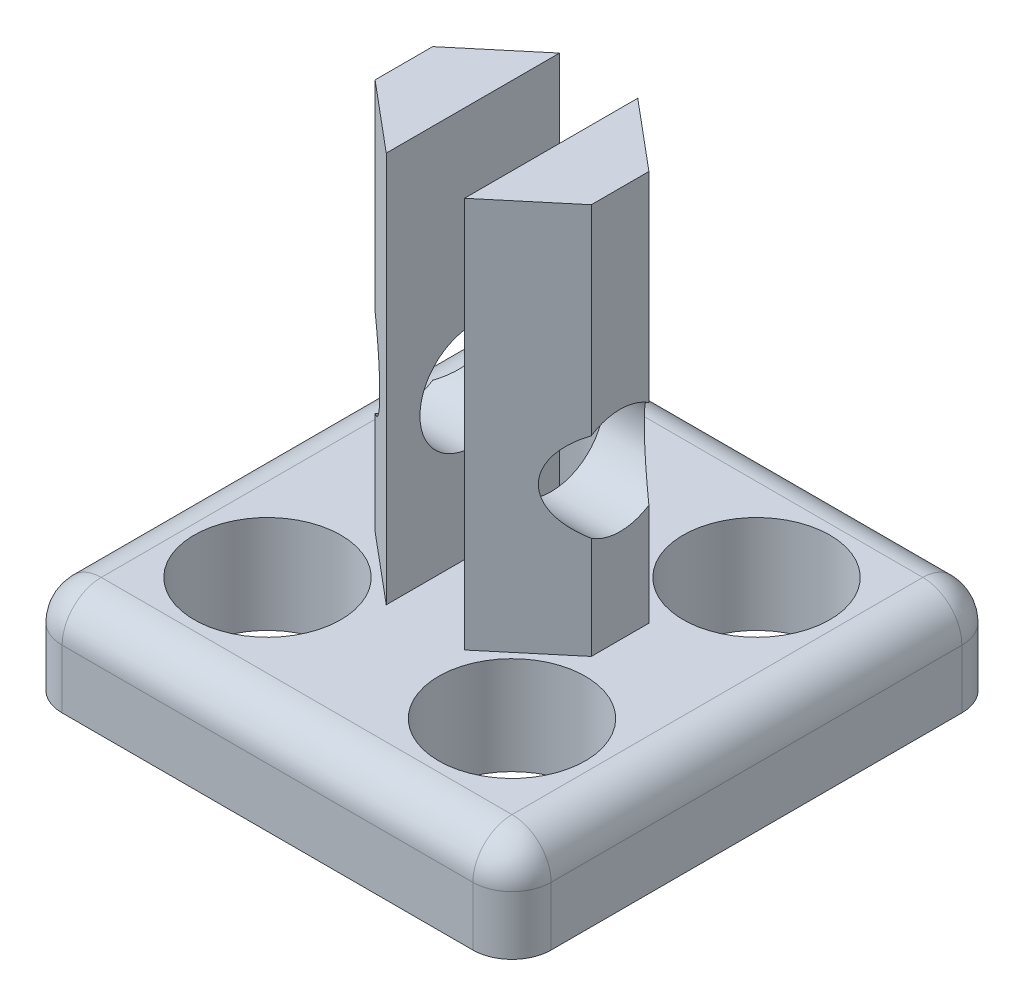
from build123d import *

# Parameters (mm, degrees)
SKETCH1_W           = 12.7
SKETCH1_H           = 12.7
SKETCH1_R           = 1.905
BOSS_EXTRUDE1_DEPTH = 2.54
BOSS_EXTRUDE2_DEPTH = 10.16
SKETCH3_R           = 1.375
CUT_EXTRUDE1_DEPTH  = 17.896123524
FILLET1_R           = 1.016


with BuildPart() as part:
    # Sketch1 → Boss-Extrude1 (new body)
    with BuildSketch(Plane(origin=(0, 0, 0), x_dir=(1, 0, 0), z_dir=(0, 1, 0))):
        Rectangle(SKETCH1_W, SKETCH1_H)
        with Locations((-3.175, 3.175)):
            Circle(SKETCH1_R, mode=Mode.SUBTRACT)
        with Locations((3.175, 3.175)):
            Circle(SKETCH1_R, mode=Mode.SUBTRACT)
        with Locations((3.175, -3.175)):
            Circle(SKETCH1_R, mode=Mode.SUBTRACT)
        with Locations((-3.175, -3.175)):
            Circle(SKETCH1_R, mode=Mode.SUBTRACT)
    extrude(amount=BOSS_EXTRUDE1_DEPTH)

    # Sketch2 → Boss-Extrude2 (add)
    with BuildSketch(Plane(origin=(0, 2.54, 0), x_dir=(1, 0, 0), z_dir=(0, 1, 0))):
        Polygon((-1.016, 2.249760645), (-2.807864934, 0.747994785), (-2.807864934, -0.747994785), (-1.016, -2.249760645), align=None)
        Polygon((2.807864934, 0.747994785), (1.016, 2.249760645), (1.016, -2.249760645), (2.807864934, -0.747994785), align=None)
    extrude(amount=BOSS_EXTRUDE2_DEPTH)

    # Sketch3 → Cut-Extrude1 (cut, through all)
    with BuildSketch(Plane(origin=(2.807864934, 0, 0), x_dir=(0, 0, -1), z_dir=(1, 0, 0))):
        with Locations((0, 6.35)):
            Circle(SKETCH3_R)
    extrude(amount=-CUT_EXTRUDE1_DEPTH, mode=Mode.SUBTRACT)

    # Fillet1
    fillet1_edges = [part.edges().sort_by_distance(p)[0] for p in [
        (6.35, 1.27, -6.35),
        (0, 2.54, -6.35),
        (-6.35, 1.27, -6.35),
        (-6.35, 1.27, 6.35),
        (-6.35, 2.54, 0),
        (6.35, 1.27, 6.35),
        (6.35, 2.54, 0),
        (0, 2.54, 6.35),
    ]]
    fillet(fillet1_edges, radius=FILLET1_R)


solid = part.part
